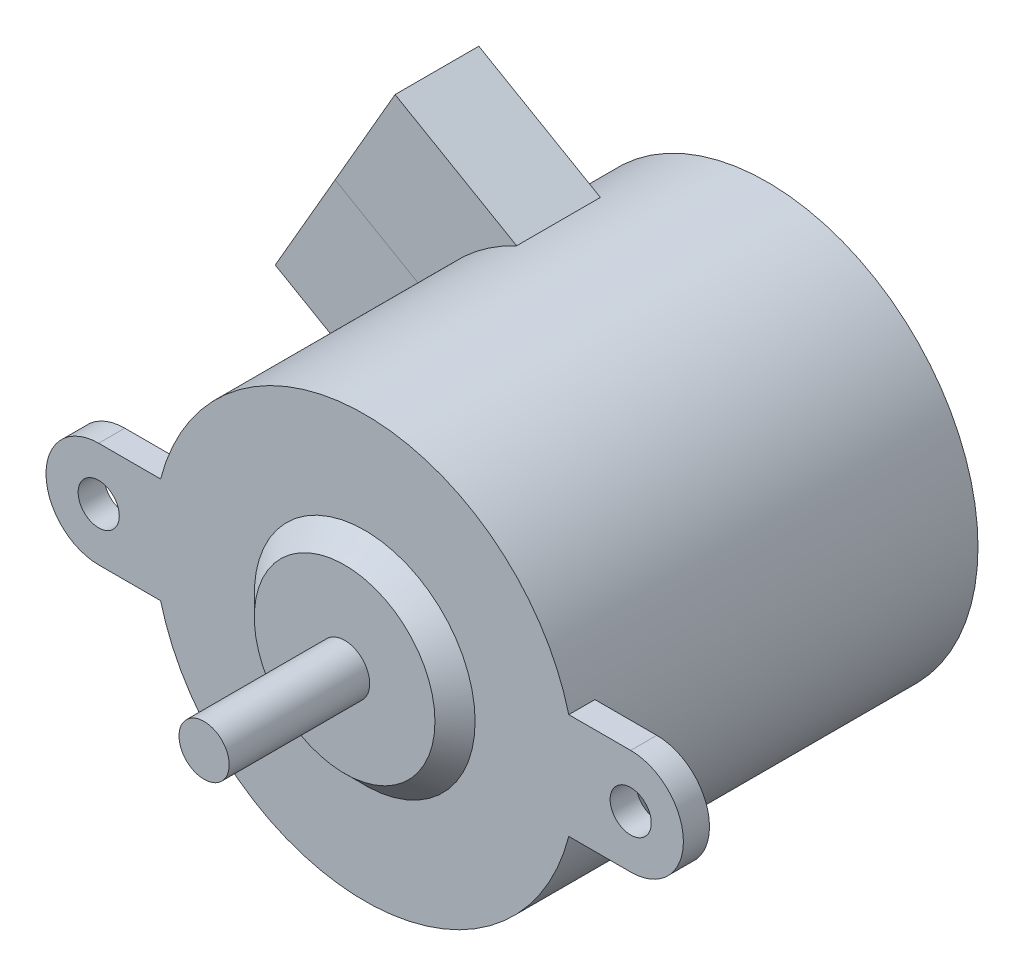
from build123d import *

# Parameters (mm, degrees)
BOSS_EXTRUDE1_DEPTH = 40.1
SKETCH3_R           = 9
SKETCH2_R           = 11
CUT_EXTRUDE1_START  = -37.5
CUT_EXTRUDE1_DEPTH  = 37.5
SKETCH6_R           = 2.05
CUT_EXTRUDE2_DEPTH  = 2.6
SKETCH7_R           = 2.5
BOSS_EXTRUDE2_DEPTH = 14
WRAP4_START         = -32.470653403
WRAP4_DEPTH         = 8.340653403
CUT_EXTRUDE4_DEPTH  = 8.340653
CUT_EXTRUDE5_DEPTH  = 14


# Read off the part's stored shape, not the designer's step: Wrap4
with BuildPart() as part:
    # Sketch1 → Boss-Extrude1 (new body)
    with BuildSketch(Plane.XY):
        with BuildLine():
            Line((26.5, 5.25), (20.333162568, 5.25))
            ThreePointArc((20.333162568, 5.25), (0, 21), (-20.333162568, 5.25))
            Line((-20.333162568, 5.25), (-26.5, 5.25))
            ThreePointArc((-26.5, 5.25), (-31.75, 0), (-26.5, -5.25))
            Line((-26.5, -5.25), (-20.333162568, -5.25))
            ThreePointArc((-20.333162568, -5.25), (0, -21), (20.333162568, -5.25))
            Line((20.333162568, -5.25), (26.5, -5.25))
            ThreePointArc((26.5, -5.25), (31.75, 0), (26.5, 5.25))
        make_face()
    extrude(amount=-BOSS_EXTRUDE1_DEPTH)

    # Sketch3 → Loft1 section 0
    with BuildSketch(Plane.XY.offset(2)):
        Circle(SKETCH3_R)
    # Sketch2 → Loft1 section 1
    with BuildSketch(Plane.XY):
        Circle(SKETCH2_R)
    loft()

    # Sketch4 → Cut-Extrude1 (cut)
    with BuildSketch(Plane(origin=(0, 0, -40.1), x_dir=(-1, 0, 0), z_dir=(0, 0, -1)).offset(CUT_EXTRUDE1_START)):
        with BuildLine():
            Line((-26.5, 5.25), (-20.333162568, 5.25))
            ThreePointArc((-20.333162568, 5.25), (-21, 0), (-20.333162568, -5.25))
            Line((-20.333162568, -5.25), (-26.5, -5.25))
            ThreePointArc((-26.5, -5.25), (-31.75, 0), (-26.5, 5.25))
        make_face()
        with BuildLine():
            Line((26.5, -5.25), (20.333162568, -5.25))
            ThreePointArc((20.333162568, -5.25), (21, 0), (20.333162568, 5.25))
            Line((20.333162568, 5.25), (26.5, 5.25))
            ThreePointArc((26.5, 5.25), (31.75, 0), (26.5, -5.25))
        make_face()
    extrude(amount=CUT_EXTRUDE1_DEPTH, mode=Mode.SUBTRACT)

    # Sketch6 → Cut-Extrude2 (cut)
    with BuildSketch(Plane.XY):
        with Locations((-26.5, 0)):
            Circle(SKETCH6_R)
        with Locations(Location((26.5, 0, 0), (0, 0, 180))):
            Circle(SKETCH6_R)
    extrude(amount=-CUT_EXTRUDE2_DEPTH, mode=Mode.SUBTRACT)

    # Sketch7 → Boss-Extrude2 (add)
    with BuildSketch(Plane.XY.offset(2)):
        Circle(SKETCH7_R)
    extrude(amount=BOSS_EXTRUDE2_DEPTH)

    # Wrap4 outline → Wrap4 (add)
    with BuildSketch(Plane.XY.offset(WRAP4_START)):
        with BuildLine():
            ThreePointArc((-20.9308697, -1.702555024), (-18.186533479, 10.5), (-8.990978947, 18.977942396))
            Line((-8.990978947, 18.977942396), (-16.269390476, 34.341038621))
            ThreePointArc((-16.269390476, 34.341038621), (-32.908965344, 19), (-37.874907076, -3.080813854))
            Line((-37.874907076, -3.080813854), (-20.9308697, -1.702555024))
        make_face()
    extrude(amount=WRAP4_DEPTH)

    # Sketch19 → Cut-Extrude4 (cut)
    with BuildSketch(Plane(origin=(0, 0, -32.470653403), x_dir=(-1, 0, 0), z_dir=(0, 0, -1))):
        with BuildLine():
            Line((16.269390476, 34.341038621), (37.874907076, -3.080813854))
            ThreePointArc((37.874907076, -3.080813854), (32.908965344, 19), (16.269390476, 34.341038621))
        make_face()
    extrude(amount=-CUT_EXTRUDE4_DEPTH, mode=Mode.SUBTRACT)

    # Sketch20 → Cut-Extrude5 (cut)
    with BuildSketch(Plane(origin=(0, 0, -32.470653403), x_dir=(-1, 0, 0), z_dir=(0, 0, -1))):
        Polygon((16.269390476, 34.341038621), (8.990978947, 18.977942396), (21.1022034, 25.970361093), align=None)
        Polygon((37.874907076, -3.080813854), (20.9308697, -1.702555024), (33.042094152, 5.289863673), align=None)
    extrude(amount=-CUT_EXTRUDE5_DEPTH, mode=Mode.SUBTRACT)


solid = part.part
